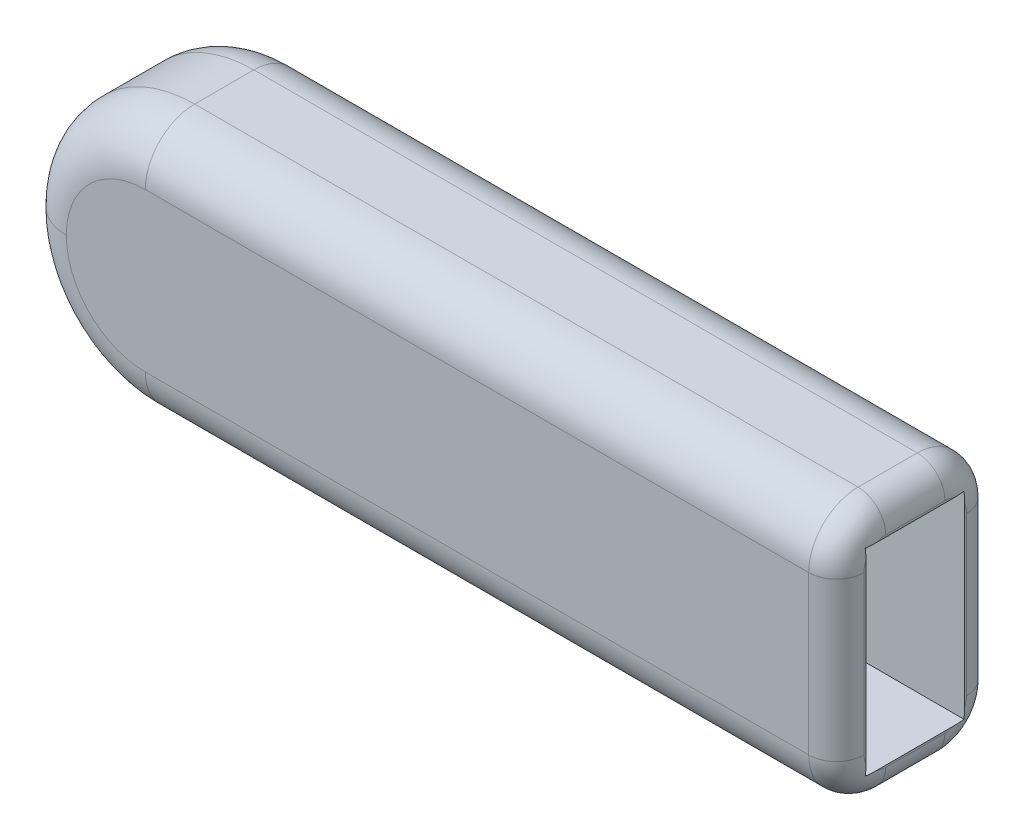
from build123d import *

# Parameters (mm, degrees)
SKETCH1_W          = 50.8
SKETCH1_H          = 12.7
BASE_EXTRUDE_DEPTH = 6.35
FILLET1_R          = 6.35
SHELL1_DEPTH       = 6.35
SHELL1_START       = -1.905
SHELL1_2_DEPTH     = 10.16
SHELL1_3_DEPTH     = 1.905
SHELL1_START_2     = 6.35
SHELL1_4_DEPTH     = 1.905
FILLET3_R          = 3.175
FILLET4_R          = 1.778


# Read off the part's stored shape, not the designer's step: Shell1
# Some blends are built 0.0001 mm under size
with BuildPart() as part:
    # Sketch1 → Base-Extrude (new body)
    with BuildSketch(Plane.XY):
        with Locations((25.4, 6.35)):
            Rectangle(SKETCH1_W, SKETCH1_H)
    extrude(amount=BASE_EXTRUDE_DEPTH)

    # Fillet1
    fillet1_edges = [part.edges().sort_by_distance(p)[0] for p in [
        (0, 0, 3.175),
        (0, 12.7, 3.175),
    ]]
    fillet(fillet1_edges, radius=FILLET1_R - 0.0001)  # a hair under: the kernel refuses the full size

    # Shell1 outline → Shell1 (cut)
    with BuildSketch(Plane.XY):
        with BuildLine():
            Line((6.35, 0), (50.8, 0))
            Line((50.8, 0), (50.8, 12.7))
            Line((50.8, 12.7), (6.35, 12.7))
            ThreePointArc((6.35, 12.7), (1.859871939, 10.840128061), (0, 6.35))
            ThreePointArc((0, 6.35), (1.859871939, 1.859871939), (6.35, 0))
        make_face()
    extrude(amount=SHELL1_DEPTH, mode=Mode.SUBTRACT)

    # Shell1 2 outline → Shell1 2 (add)
    with BuildSketch(Plane.XY.offset(SHELL1_START)):
        with BuildLine():
            Line((6.35, -1.905), (50.8, -1.905))
            Line((50.8, -1.905), (50.8, 0))
            Line((50.8, 0), (6.35, 0))
            ThreePointArc((6.35, 0), (1.859871939, 1.859871939), (0, 6.35))
            ThreePointArc((0, 6.35), (1.859871939, 10.840128061), (6.35, 12.7))
            Line((6.35, 12.7), (50.8, 12.7))
            Line((50.8, 12.7), (50.8, 14.605))
            Line((50.8, 14.605), (6.35, 14.605))
            ThreePointArc((6.35, 14.605), (0.512833521, 12.187166479), (-1.905, 6.35))
            ThreePointArc((-1.905, 6.35), (0.512833521, 0.512833521), (6.35, -1.905))
        make_face()
    extrude(amount=SHELL1_2_DEPTH)

    # Shell1 3 outline → Shell1 3 (add)
    with BuildSketch(Plane.XY.offset(SHELL1_START)):
        with BuildLine():
            Line((6.35, 0), (50.8, 0))
            Line((50.8, 0), (50.8, 12.7))
            Line((50.8, 12.7), (6.35, 12.7))
            ThreePointArc((6.35, 12.7), (1.859871939, 10.840128061), (0, 6.35))
            ThreePointArc((0, 6.35), (1.859871939, 1.859871939), (6.35, 0))
        make_face()
    extrude(amount=SHELL1_3_DEPTH)

    # Shell1 4 outline → Shell1 4 (add)
    with BuildSketch(Plane.XY.offset(SHELL1_START_2)):
        with BuildLine():
            Line((6.35, 0), (50.8, 0))
            Line((50.8, 0), (50.8, 12.7))
            Line((50.8, 12.7), (6.35, 12.7))
            ThreePointArc((6.35, 12.7), (1.859871939, 10.840128061), (0, 6.35))
            ThreePointArc((0, 6.35), (1.859871939, 1.859871939), (6.35, 0))
        make_face()
    extrude(amount=SHELL1_4_DEPTH)

    # Fillet3
    fillet3_edges = [part.edges().sort_by_distance(p)[0] for p in [
        (28.575, -1.905, -1.905),
        (0.512833521, 0.512833521, -1.905),
        (0.512833521, 12.187166479, -1.905),
        (28.575, -1.905, 8.255),
        (0.512833521, 0.512833521, 8.255),
        (0.512833521, 12.187166479, 8.255),
        (28.575, 14.605, -1.905),
        (28.575, 14.605, 8.255),
    ]]
    fillet(fillet3_edges, radius=FILLET3_R)

    # Fillet4
    # the kernel refuses this fillet: 1.778 mm, written as the material it takes off along each edge
    with BuildSketch(Plane(origin=(50.8, -1.905, 1.27), x_dir=(0, 1, 0), z_dir=(0, 0, 1))) as fillet4_piece_1:
        with BuildLine():
            CenterArc((FILLET4_R, FILLET4_R), FILLET4_R, 180, 90)
            Line((0, FILLET4_R), (0, 0))
            Line((0, 0), (FILLET4_R, 0))
        make_face()
    extrude(amount=3.81, mode=Mode.SUBTRACT)
    with BuildSketch(Plane(origin=(50.8, 1.27, -1.905), x_dir=(0, 0, 1), z_dir=(0, 1, 0)), Plane(origin=(50.8, 11.43, 8.255), x_dir=(0, 0, -1), z_dir=(0, -1, 0))) as fillet4_piece_2:
        with BuildLine():
            CenterArc((FILLET4_R, -FILLET4_R), FILLET4_R, 90, 90)
            Line((0, -FILLET4_R), (0, 0))
            Line((0, 0), (FILLET4_R, 0))
        make_face()
    extrude(amount=10.16, mode=Mode.SUBTRACT)
    with BuildSketch(Plane(origin=(50.8, 14.605, 1.27), x_dir=(0, -1, 0), z_dir=(0, 0, 1))) as fillet4_piece_3:
        with BuildLine():
            CenterArc((FILLET4_R, -FILLET4_R), FILLET4_R, 90, 90)
            Line((0, -FILLET4_R), (0, 0))
            Line((0, 0), (FILLET4_R, 0))
        make_face()
    extrude(amount=3.81, mode=Mode.SUBTRACT)
    with BuildSketch(Plane(origin=(50.8, 11.43, 5.08), x_dir=(0, 1, 0), z_dir=(0, 0, -1))) as fillet4_piece_4:
        with BuildLine():
            CenterArc((3.175 - FILLET4_R, -FILLET4_R), FILLET4_R, 0, 90)
            Line((3.175, -FILLET4_R), (3.175, 0))
            Line((3.175, 0), (3.175 - FILLET4_R, 0))
        make_face()
    revolve(axis=Axis((50.8, 11.43, 5.08), (1, 0, 0)), revolution_arc=90, mode=Mode.SUBTRACT)
    with BuildSketch(Plane(origin=(50.8, 11.43, 1.27), x_dir=(0, 1, 0), z_dir=(0, 0, 1))) as fillet4_piece_5:
        with BuildLine():
            CenterArc((3.175 - FILLET4_R, FILLET4_R), FILLET4_R, 270, 90)
            Line((3.175, FILLET4_R), (3.175, 0))
            Line((3.175, 0), (3.175 - FILLET4_R, 0))
        make_face()
    revolve(axis=Axis((50.8, 11.43, 1.27), (-1, 0, 0)), revolution_arc=90, mode=Mode.SUBTRACT)
    with BuildSketch(Plane(origin=(50.8, 1.27, 5.08), x_dir=(0, -1, 0), z_dir=(0, 0, -1))) as fillet4_piece_6:
        with BuildLine():
            CenterArc((3.175 - FILLET4_R, FILLET4_R), FILLET4_R, 270, 90)
            Line((3.175, FILLET4_R), (3.175, 0))
            Line((3.175, 0), (3.175 - FILLET4_R, 0))
        make_face()
    revolve(axis=Axis((50.8, 1.27, 5.08), (-1, 0, 0)), revolution_arc=90, mode=Mode.SUBTRACT)
    with BuildSketch(Plane(origin=(50.8, 1.27, 1.27), x_dir=(0, -1, 0), z_dir=(0, 0, 1))) as fillet4_piece_7:
        with BuildLine():
            CenterArc((3.175 - FILLET4_R, -FILLET4_R), FILLET4_R, 0, 90)
            Line((3.175, -FILLET4_R), (3.175, 0))
            Line((3.175, 0), (3.175 - FILLET4_R, 0))
        make_face()
    revolve(axis=Axis((50.8, 1.27, 1.27), (1, 0, 0)), revolution_arc=90, mode=Mode.SUBTRACT)


solid = part.part
